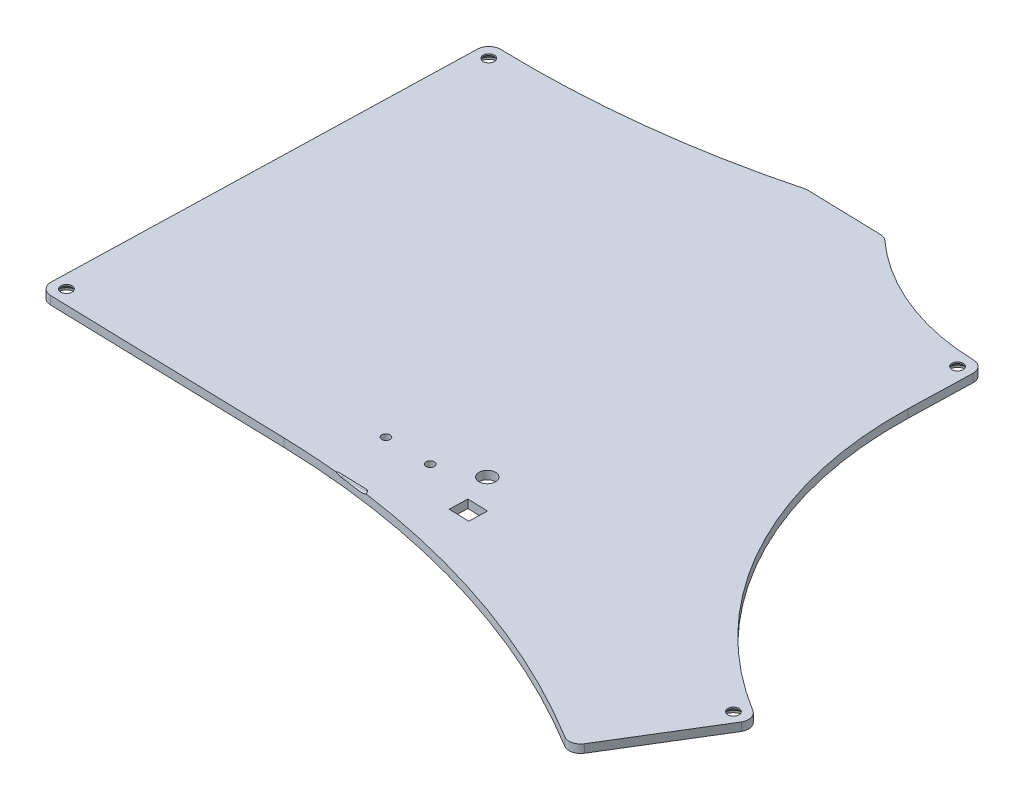
from build123d import *

# Parameters (mm, degrees)
SKETCH7_R                = 1
SKETCH7_R_2              = 2
SKETCH7_R_3              = 1.35
MAIN_PLATE_DEPTH         = 2
CHARGE_PORT_FLLET_R      = 0.3
SKETCH10_R               = 2.5
SCREW_HOLES_DEPTH        = 1.7
SCREW_HOLES_CHAMFER_SIZE = 1.2


with BuildPart() as part:
    # Sketch7 → Main_plate (new body)
    with BuildSketch(Plane(origin=(0, 0, 0), x_dir=(1, 0, 0), z_dir=(0, 1, 0))):
        with BuildLine():
            Line((-104.023215078, 7.316749514), (-106.797390349, -93.144954391))
            ThreePointArc((-106.797390349, -93.144954391), (-106.032254445, -95.146736777), (-104.07574776, -96.021177891))
            Line((-104.07574776, -96.021177891), (-45.885269032, -97.628064702))
            ThreePointArc((-45.885269032, -97.628064702), (4.285255603, -105.624406052), (50.695402381, -126.291319055))
            ThreePointArc((50.695402381, -126.291319055), (52.812174305, -126.625747368), (54.545434613, -125.365440114))
            Line((54.545434613, -125.365440114), (68.990750601, -101.772440989))
            ThreePointArc((68.990750601, -101.772440989), (69.223862062, -99.714931621), (67.981742697, -98.05818021))
            ThreePointArc((67.981742697, -98.05818021), (34.717808657, -63.000530051), (23.481809811, -15.997546396))
            Line((23.481809811, -15.997546396), (23.903754887, -0.717574065))
            ThreePointArc((23.903754887, -0.717574065), (23.138618984, 1.284208321), (21.182112299, 2.158649434))
            ThreePointArc((21.182112299, 2.158649434), (2.003898261, 6.128244847), (-14.619536468, 16.483098745))
            ThreePointArc((-14.619536468, 16.483098745), (-15.454114646, 17.002963336), (-16.41695531, 17.202256548))
            Line((-16.41695531, 17.202256548), (-34.410096308, 17.699123761))
            ThreePointArc((-34.410096308, 17.699123761), (-34.806702023, 17.681923588), (-35.196889178, 17.608807767))
            ThreePointArc((-35.196889178, 17.608807767), (-67.90293394, 11.4801352), (-101.146991579, 10.038392103))
            ThreePointArc((-101.146991579, 10.038392103), (-103.148773965, 9.273256199), (-104.023215078, 7.316749514))
        make_face()
        with Locations(Location((-33.748541786, -85.138324407, 0), (0, 0, 270))):
            Circle(SKETCH7_R, mode=Mode.SUBTRACT)
        with Locations(Location((-22.752733399, -85.441965481, 0), (0, 0, 270))):
            Circle(SKETCH7_R, mode=Mode.SUBTRACT)
        with Locations(Location((-13.132688699, -81.225908084, 0), (0, 0, 270))):
            Circle(SKETCH7_R_2, mode=Mode.SUBTRACT)
        with Locations(Location((-103.484845965, -92.736237241, 0), (0, 0, 270))):
            Circle(SKETCH7_R_3, mode=Mode.SUBTRACT)
        with Locations(Location((-100.738259931, 6.72637273, 0), (0, 0, 270))):
            Circle(SKETCH7_R_3, mode=Mode.SUBTRACT)
        with Locations(Location((20.591268917, -1.124175901, 0), (0, 0, 270))):
            Circle(SKETCH7_R_3, mode=Mode.SUBTRACT)
        with Locations(Location((65.832836662, -100.610366639, 0), (0, 0, 270))):
            Circle(SKETCH7_R_3, mode=Mode.SUBTRACT)
        Polygon((-10.87408805, -88.190907948), (-5.975955223, -88.326166245), (-6.097411653, -92.7244896), (-10.99554448, -92.589231303), align=None, mode=Mode.SUBTRACT)
    extrude(amount=-MAIN_PLATE_DEPTH)

    # Sketch8 → Charge_port section 0
    with BuildSketch(Plane(origin=(-2.734355993, 0, 99.019721328), x_dir=(0.9996189443320018, 0, 0.027603734033176643), z_dir=(-0.027603734033176643, 0, 0.9996189443320018))):
        with BuildLine():
            Line((-28.28554605, 7.25), (-23.48554605, 7.25))
            ThreePointArc((-23.48554605, 7.25), (-19.73554605, 3.5), (-23.48554605, -0.25))
            Line((-23.48554605, -0.25), (-28.28554605, -0.25))
            ThreePointArc((-28.28554605, -0.25), (-32.03554605, 3.5), (-28.28554605, 7.25))
        make_face()
    # Sketch9 → Charge_port section 1
    with BuildSketch(Plane(origin=(-2.872374664, 0, 104.017816049), x_dir=(0.9996189443320018, 0, 0.027603734033176643), z_dir=(-0.027603734033176643, 0, 0.9996189443320018))):
        with BuildLine():
            Line((-28.28554605, -1.75), (-23.48554605, -1.75))
            ThreePointArc((-23.48554605, -1.75), (-18.23554605, 3.5), (-23.48554605, 8.75))
            Line((-23.48554605, 8.75), (-28.28554605, 8.75))
            ThreePointArc((-28.28554605, 8.75), (-33.53554605, 3.5), (-28.28554605, -1.75))
        make_face()
    loft(mode=Mode.SUBTRACT)

    # Charge_port_fllet
    charge_port_fllet_edges = [part.edges().sort_by_distance(p)[0] for p in [
        (-31.693515982, -0.186970301, 98.220035653),
        (-25.526560437, -0.186970301, 98.390331546),
        (-28.61003821, -0.25, 98.305183599),
    ]]
    fillet(charge_port_fllet_edges, radius=CHARGE_PORT_FLLET_R)

    # Sketch10 → Screw_holes (cut)
    with BuildSketch(Plane.XZ.offset(2)):
        with Locations(Location((-103.484845965, 92.736237241, 0), (0, 0, 270))):
            Circle(SKETCH10_R)
        with Locations(Location((65.832836662, 100.610366639, 0), (0, 0, 270))):
            Circle(SKETCH10_R)
        with Locations(Location((20.591268917, 1.124175901, 0), (0, 0, 270))):
            Circle(SKETCH10_R)
        with Locations(Location((-100.738259931, -6.72637273, 0), (0, 0, 270))):
            Circle(SKETCH10_R)
    extrude(amount=-SCREW_HOLES_DEPTH, mode=Mode.SUBTRACT)

    # Screw_holes_chamfer
    # the kernel refuses this chamfer: 1.2 mm, written as the material it adds along each edge
    with BuildSketch(Plane(origin=(65.832836662, -0.3, 100.610366639), x_dir=(0, 0, -1), z_dir=(-1, 0, 0))) as screw_holes_chamfer_piece_1_section:
        Polygon((2.5 - SCREW_HOLES_CHAMFER_SIZE, 0), (2.5, SCREW_HOLES_CHAMFER_SIZE), (2.5, 0), align=None)
    screw_holes_chamfer_piece_1 = revolve(axis=Axis((65.832836662, -0.3, 100.610366639), (0, -1, 0)), mode=Mode.PRIVATE)
    screw_holes_chamfer_piece_1 = screw_holes_chamfer_piece_1 - Plane(origin=(65.832836662, -0.926520071, 100.610366639), x_dir=(0, 0, 1), z_dir=(0, 1, 0)) * Cylinder(1.35, 11, mode=Mode.PRIVATE)
    add(screw_holes_chamfer_piece_1)
    with BuildSketch(Plane(origin=(-103.484845965, -0.3, 92.736237241), x_dir=(0, 0, -1), z_dir=(-1, 0, 0))) as screw_holes_chamfer_piece_2_section:
        Polygon((2.5 - SCREW_HOLES_CHAMFER_SIZE, 0), (2.5, SCREW_HOLES_CHAMFER_SIZE), (2.5, 0), align=None)
    screw_holes_chamfer_piece_2 = revolve(axis=Axis((-103.484845965, -0.3, 92.736237241), (0, -1, 0)), mode=Mode.PRIVATE)
    screw_holes_chamfer_piece_2 = screw_holes_chamfer_piece_2 - Plane(origin=(-103.484845965, -0.926520071, 92.736237241), x_dir=(0, 0, 1), z_dir=(0, 1, 0)) * Cylinder(1.35, 11, mode=Mode.PRIVATE)
    add(screw_holes_chamfer_piece_2)
    with BuildSketch(Plane(origin=(-100.738259931, -0.3, -6.72637273), x_dir=(0, 0, -1), z_dir=(-1, 0, 0))) as screw_holes_chamfer_piece_3_section:
        Polygon((2.5 - SCREW_HOLES_CHAMFER_SIZE, 0), (2.5, SCREW_HOLES_CHAMFER_SIZE), (2.5, 0), align=None)
    screw_holes_chamfer_piece_3 = revolve(axis=Axis((-100.738259931, -0.3, -6.72637273), (0, -1, 0)), mode=Mode.PRIVATE)
    screw_holes_chamfer_piece_3 = screw_holes_chamfer_piece_3 - Plane(origin=(-100.738259931, -0.926520071, -6.72637273), x_dir=(0, 0, 1), z_dir=(0, 1, 0)) * Cylinder(1.35, 10, mode=Mode.PRIVATE)
    add(screw_holes_chamfer_piece_3)
    with BuildSketch(Plane(origin=(20.591268917, -0.3, 1.124175901), x_dir=(0, 0, -1), z_dir=(-1, 0, 0))) as screw_holes_chamfer_piece_4_section:
        Polygon((2.5 - SCREW_HOLES_CHAMFER_SIZE, 0), (2.5, SCREW_HOLES_CHAMFER_SIZE), (2.5, 0), align=None)
    screw_holes_chamfer_piece_4 = revolve(axis=Axis((20.591268917, -0.3, 1.124175901), (0, -1, 0)), mode=Mode.PRIVATE)
    screw_holes_chamfer_piece_4 = screw_holes_chamfer_piece_4 - Plane(origin=(20.591268917, -0.926520071, 1.124175901), x_dir=(0, 0, 1), z_dir=(0, 1, 0)) * Cylinder(1.35, 10, mode=Mode.PRIVATE)
    add(screw_holes_chamfer_piece_4)


solid = part.part
